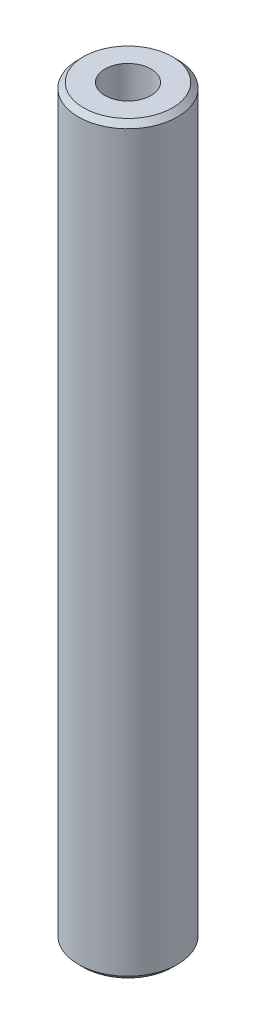
from build123d import *

# Parameters (mm, degrees)
SKETCH1_R           = 40
BOSS_EXTRUDE1_DEPTH = 600
SKETCH2_R           = 18.577813377
CUT_EXTRUDE1_DEPTH  = 603.660766933
CHAMFER1_SIZE       = 4.219824171


with BuildPart() as part:
    # Sketch1 → Boss-Extrude1 (new body)
    with BuildSketch(Plane(origin=(0, 0, 0), x_dir=(1, 0, 0), z_dir=(0, 1, 0))):
        Circle(SKETCH1_R)
    extrude(amount=BOSS_EXTRUDE1_DEPTH)

    # Sketch2 → Cut-Extrude1 (cut, through all)
    with BuildSketch(Plane(origin=(0, 0, 0), x_dir=(1, 0, 0), z_dir=(0, 1, 0))):
        Circle(SKETCH2_R)
    extrude(amount=CUT_EXTRUDE1_DEPTH, mode=Mode.SUBTRACT)

    # Chamfer1
    chamfer1_edges = [part.edges().sort_by_distance(p)[0] for p in [
        (-40, 600, 0),
        (-40, 0, 0),
    ]]
    chamfer(chamfer1_edges, length=CHAMFER1_SIZE)


solid = part.part
